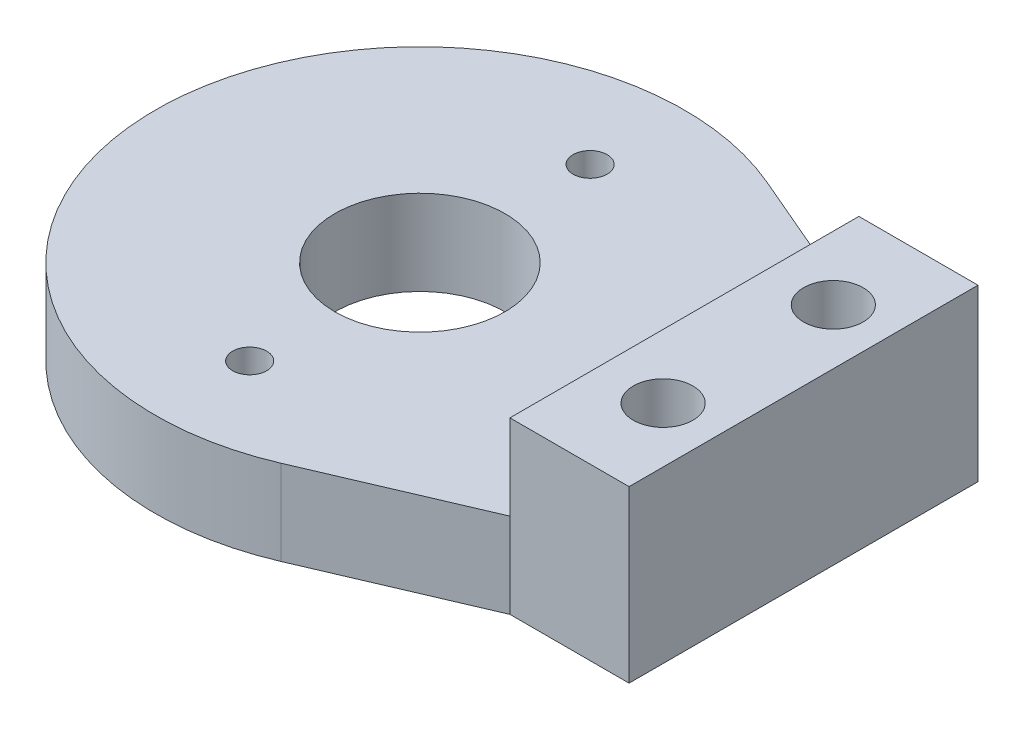
from build123d import *

# Parameters (mm, degrees)
SKETCH1_W               = 7
SKETCH1_H               = 20.5
MOUNTINGBASE_DEPTH      = 10
SKETCH2_R               = 1.75
MOUNTINGHOLES_DEPTH     = 10
HORNTAB_DEPTH           = 5
SKETCH4_R               = 1
SKETCH4_R_2             = 5
HORNMOUNTINGHOLES_DEPTH = 5


with BuildPart() as part:
    # Sketch1 → mountingBase (new body)
    with BuildSketch(Plane(origin=(0, 0, 0), x_dir=(1, 0, 0), z_dir=(0, 1, 0))):
        with Locations((3.5, -10.25)):
            Rectangle(SKETCH1_W, SKETCH1_H)
    extrude(amount=MOUNTINGBASE_DEPTH)

    # Sketch2 → mountingHoles (cut)
    with BuildSketch(Plane(origin=(0, 10, 0), x_dir=(1, 0, 0), z_dir=(0, 1, 0))):
        with Locations((3.75, -5.25)):
            Circle(SKETCH2_R)
        with Locations((3.75, -15.25)):
            Circle(SKETCH2_R)
    extrude(amount=-MOUNTINGHOLES_DEPTH, mode=Mode.SUBTRACT)

    # Sketch3 → hornTab (add)
    with BuildSketch(Plane(origin=(0, 0, 0), x_dir=(1, 0, 0), z_dir=(0, 1, 0))):
        with BuildLine():
            Line((0, 0), (-9.422358224, 4.035054584))
            ThreePointArc((-9.422358224, 4.035054584), (-31.07965246, -10.25), (-9.422358224, -24.535054584))
            Line((-9.422358224, -24.535054584), (0, -20.5))
            Line((0, -20.5), (0, 0))
        make_face()
    extrude(amount=HORNTAB_DEPTH)

    # Sketch4 → hornMountingHoles (cut)
    with BuildSketch(Plane(origin=(0, 5, 0), x_dir=(1, 0, 0), z_dir=(0, 1, 0))):
        with Locations((-15.53982623, -0.25)):
            Circle(SKETCH4_R)
        with Locations((-15.53982623, -20.25)):
            Circle(SKETCH4_R)
        with Locations((-15.53982623, -10.25)):
            Circle(SKETCH4_R_2)
    extrude(amount=-HORNMOUNTINGHOLES_DEPTH, mode=Mode.SUBTRACT)


solid = part.part
